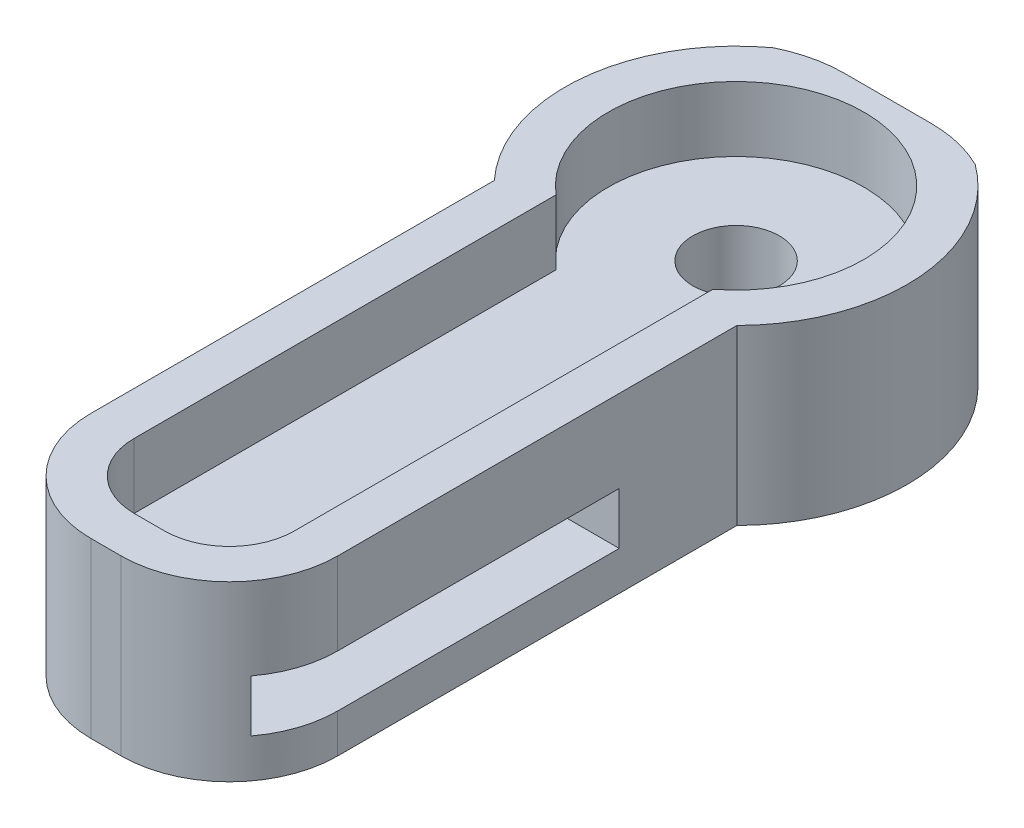
from build123d import *

# Parameters (mm, degrees)
SKETCH_1_W          = 8
SKETCH_1_H          = 18
EXTRUDE_1_DEPTH     = 4
CUT_EXTRUDE_4_DEPTH = 1.5
SKETCH_6_W          = 8
SKETCH_6_H          = 1.2
CUT_EXTRUDE_5_DEPTH = 13.68857754
SKETCH_7_R          = 1
CUT_EXTRUDE_6_DEPTH = 11.161200716
FILLET_1_R          = 3
FILLET_2_R          = 2
FILLET_3_R          = 1.5
CUT_EXTRUDE_START   = -4
CUT_EXTRUDE_7_DEPTH = 4


# Read off the part's stored shape, not the designer's step: 切除-拉伸7
with BuildPart() as part:
    # 草图1 → 凸台-拉伸1 (new body)
    with BuildSketch(Plane(origin=(0, 0, 0), x_dir=(1, 0, 0), z_dir=(0, 1, 0))):
        Rectangle(SKETCH_1_W, SKETCH_1_H)
    extrude(amount=EXTRUDE_1_DEPTH)

    # 草图5 → 切除-拉伸4 (cut)
    with BuildSketch(Plane(origin=(0, 4, 0), x_dir=(1, 0, 0), z_dir=(0, 1, 0))):
        with BuildLine():
            Line((1.802116427, -8), (-1.897883573, -8))
            Line((-1.897883573, -8), (-1.897883573, 3.241562942))
            ThreePointArc((-1.897883573, 3.241562942), (0.061482678, 8.449359232), (1.802116427, 3.164432321))
            Line((1.802116427, 3.164432321), (1.802116427, -8))
        make_face()
    extrude(amount=-CUT_EXTRUDE_4_DEPTH, mode=Mode.SUBTRACT)

    # 草图6 → 切除-拉伸5 (cut, through all)
    with BuildSketch(Plane(origin=(4, 0, 0), x_dir=(0, 0, -1), z_dir=(1, 0, 0))):
        with Locations((-4, 1.5)):
            Rectangle(SKETCH_6_W, SKETCH_6_H)
    extrude(amount=-CUT_EXTRUDE_5_DEPTH, mode=Mode.SUBTRACT)

    # 草图7 → 切除-拉伸6 (cut, through all)
    with BuildSketch(Plane(origin=(0, 2.5, 0), x_dir=(1, 0, 0), z_dir=(0, 1, 0))):
        with Locations(Location((0, 5.5, 0), (0, 0, 270))):
            Circle(SKETCH_7_R)
    extrude(amount=-CUT_EXTRUDE_6_DEPTH, mode=Mode.SUBTRACT)

    # 圆角1
    fillet_1_edges = [part.edges().sort_by_distance(p)[0] for p in [
        (-4, 2, -9),
        (4, 2, -9),
    ]]
    fillet(fillet_1_edges, radius=FILLET_1_R)

    # 圆角2
    # the kernel refuses this fillet: 2 mm, written as the material it takes off along each edge
    with BuildSketch(Plane(origin=(4, -5, 9), x_dir=(0, 0, -1), z_dir=(0, 1, 0)), Plane(origin=(-4, -5, 9), x_dir=(1, 0, 0), z_dir=(0, 1, 0))) as fillet_2_piece_1:
        with BuildLine():
            CenterArc((FILLET_2_R, FILLET_2_R), FILLET_2_R, 180, 90)
            Line((0, FILLET_2_R), (0, 0))
            Line((0, 0), (FILLET_2_R, 0))
        make_face()
    extrude(amount=14, mode=Mode.SUBTRACT)

    # 圆角3
    fillet_3_edges = [part.edges().sort_by_distance(p)[0] for p in [
        (1.802116427, 3.25, 8),
        (-1.897883573, 3.25, 8),
    ]]
    fillet(fillet_3_edges, radius=FILLET_3_R)

    # 切除-拉伸7 outline → 切除-拉伸7 (cut)
    with BuildSketch(Plane(origin=(0, 4, 0), x_dir=(1, 0, 0), z_dir=(0, 1, 0)).offset(CUT_EXTRUDE_START)):
        with BuildLine():
            ThreePointArc((-2.897883573, 2.815829589), (-3.931803195, 5.878713127), (-2.332278942, 8.687942116))
            ThreePointArc((-2.332278942, 8.687942116), (-3.549199564, 7.581638893), (-4, 6))
            Line((-4, 6), (-4, -7))
            ThreePointArc((-4, -7), (-3.414213562, -8.414213562), (-2, -9))
            Line((-2, -9), (-0.397883573, -9))
            ThreePointArc((-0.397883573, -9), (-2.165650526, -8.267766953), (-2.897883573, -6.5))
            Line((-2.897883573, -6.5), (-2.897883573, 2.815829589))
        make_face()
        with BuildLine():
            Line((4, -7), (4, 6))
            ThreePointArc((4, 6), (3.549199564, 7.581638893), (2.332278942, 8.687942117))
            ThreePointArc((2.332278942, 8.687942117), (3.937831945, 5.809805707), (2.802116427, 2.71600224))
            Line((2.802116427, 2.71600224), (2.802116427, -6.5))
            ThreePointArc((2.802116427, -6.5), (2.06988338, -8.267766953), (0.302116427, -9))
            Line((0.302116427, -9), (2, -9))
            ThreePointArc((2, -9), (3.414213562, -8.414213562), (4, -7))
        make_face()
    extrude(amount=CUT_EXTRUDE_7_DEPTH, mode=Mode.SUBTRACT)


solid = part.part
